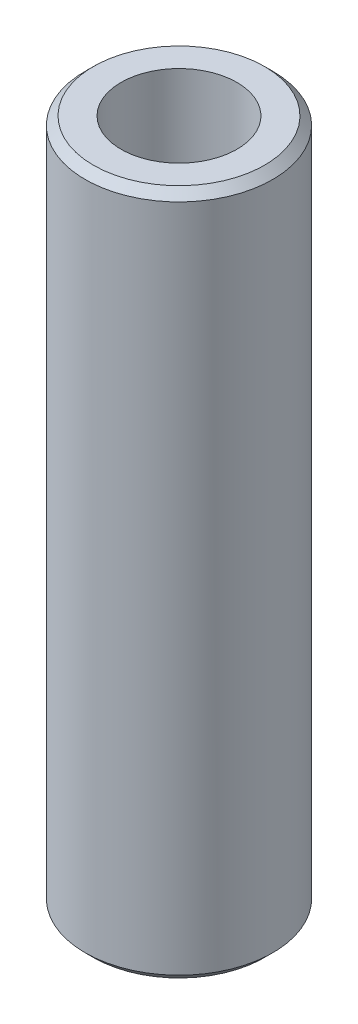
from build123d import *

# Parameters (mm, degrees)
SKETCH1_R           = 47.5
BOSS_EXTRUDE1_DEPTH = 347.431284477
SKETCH2_R           = 29.353761735
CUT_EXTRUDE1_DEPTH  = 354.865790143
CHAMFER1_SIZE       = 4.171058052


with BuildPart() as part:
    # Sketch1 → Boss-Extrude1 (new body)
    with BuildSketch(Plane(origin=(0, 0, 0), x_dir=(1, 0, 0), z_dir=(0, 1, 0))):
        Circle(SKETCH1_R)
    extrude(amount=BOSS_EXTRUDE1_DEPTH)

    # Sketch2 → Cut-Extrude1 (cut, through all)
    with BuildSketch(Plane(origin=(0, 0, 0), x_dir=(1, 0, 0), z_dir=(0, 1, 0))):
        Circle(SKETCH2_R)
    extrude(amount=CUT_EXTRUDE1_DEPTH, mode=Mode.SUBTRACT)

    # Chamfer1
    chamfer1_edges = [part.edges().sort_by_distance(p)[0] for p in [
        (-47.5, 347.431284477, 0),
        (-47.5, 0, 0),
    ]]
    chamfer(chamfer1_edges, length=CHAMFER1_SIZE)


solid = part.part
